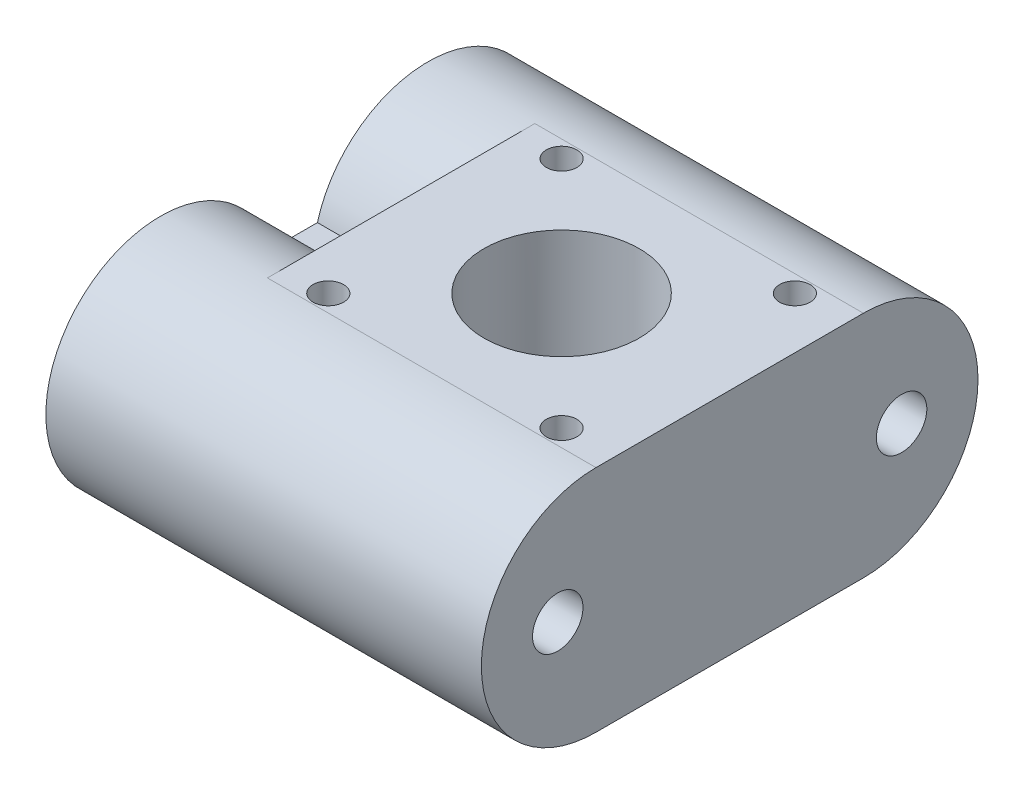
from build123d import *

# Parameters (mm, degrees)
SKETCH1_W             = 35
SKETCH1_H             = 32.5
BOSS_EXTRUDE1_DEPTH   = 15
SKETCH2_R             = 5.08
CUT_EXTRUDE2_DEPTH    = 30
SKETCH4_R             = 1
CUT_EXTRUDE3_DEPTH    = 15
M4X0_7_TAPPED_HOLE1_D = 3.3
FILLET1_RADIUS        = 7.5
FILLET1_LENGTH        = 35
FILLET2_RADIUS        = 7.5
FILLET2_LENGTH        = 35
SKETCH19_W            = 6.5
SKETCH19_H            = 32.5
CUT_EXTRUDE13_DEPTH   = 29.201285432
CUT_EXTRUDE14_START   = -7
CUT_EXTRUDE14_DEPTH   = 7


# Read off the part's stored shape, not the designer's step: Cut-Extrude14
with BuildPart() as part:
    # Sketch1 → Boss-Extrude1 (new body)
    with BuildSketch(Plane(origin=(0, 0, 0), x_dir=(1, 0, 0), z_dir=(0, 1, 0))):
        Rectangle(SKETCH1_W, SKETCH1_H)
    extrude(amount=-BOSS_EXTRUDE1_DEPTH)

    # Sketch2 → Cut-Extrude2 (cut)
    with BuildSketch(Plane(origin=(0, 0, 0), x_dir=(1, 0, 0), z_dir=(0, 1, 0))):
        with Locations(Location((0, 0, 0), (0, 0, 270))):
            Circle(SKETCH2_R)
    extrude(amount=-CUT_EXTRUDE2_DEPTH, mode=Mode.SUBTRACT)

    # Sketch4 → Cut-Extrude3 (cut)
    with BuildSketch(Plane(origin=(0, 0, 0), x_dir=(1, 0, 0), z_dir=(0, 1, 0))):
        with Locations(Location((7.633, 7.633, 0), (0, 0, 270))):
            Circle(SKETCH4_R)
        with Locations(Location((-7.633, 7.633, 0), (0, 0, 270))):
            Circle(SKETCH4_R)
        with Locations(Location((-7.633, -7.633, 0), (0, 0, 270))):
            Circle(SKETCH4_R)
        with Locations(Location((7.633, -7.633, 0), (0, 0, 270))):
            Circle(SKETCH4_R)
    extrude(amount=-CUT_EXTRUDE3_DEPTH, mode=Mode.SUBTRACT)

    # M4x0.7 Tapped Hole1 (through all)
    with Locations(Plane(origin=(-17.5, 0, 0), x_dir=(0, -1, 0), z_dir=(-1, 0, 0))):
        with Locations((7.5, -11.25), (7.5, 11.25)):
            Hole(M4X0_7_TAPPED_HOLE1_D / 2)

    # Fillet1: full round fillet: the end face becomes a half cylinder, R = half its width
    fillet1_face = Plane((0, -7.5, -16.25), x_dir=(1, 0, 0), z_dir=(0, 0, -1))  # on the end face: x along it, z out of the body
    fillet1_slab = fillet1_face.offset(-FILLET1_RADIUS / 2) * Box(FILLET1_LENGTH, 2 * FILLET1_RADIUS, FILLET1_RADIUS, mode=Mode.PRIVATE)  # the body's end, R deep
    fillet1_round = Plane((0, -7.5, -8.75), x_dir=(0, 0, -1), z_dir=(1, 0, 0)) * Cylinder(FILLET1_RADIUS, FILLET1_LENGTH, mode=Mode.PRIVATE)  # its axis R under the face
    add(fillet1_slab - fillet1_round, mode=Mode.SUBTRACT)

    # Fillet2: full round fillet: the end face becomes a half cylinder, R = half its width
    fillet2_face = Plane((0, -7.5, 16.25), x_dir=(1, 0, 0), z_dir=(0, 0, 1))  # on the end face: x along it, z out of the body
    fillet2_slab = fillet2_face.offset(-FILLET2_RADIUS / 2) * Box(FILLET2_LENGTH, 2 * FILLET2_RADIUS, FILLET2_RADIUS, mode=Mode.PRIVATE)  # the body's end, R deep
    fillet2_round = Plane((0, -7.5, 8.75), x_dir=(0, 0, 1), z_dir=(1, 0, 0)) * Cylinder(FILLET2_RADIUS, FILLET2_LENGTH, mode=Mode.PRIVATE)  # its axis R under the face
    add(fillet2_slab - fillet2_round, mode=Mode.SUBTRACT)

    # Sketch19 → Cut-Extrude13 (cut, through all)
    with BuildSketch(Plane.XZ.offset(15)):
        with Locations((14.25, 0)):
            Rectangle(SKETCH19_W, SKETCH19_H)
    extrude(amount=-CUT_EXTRUDE13_DEPTH, mode=Mode.SUBTRACT)

    # Cut-Extrude14 outline → Cut-Extrude14 (cut)
    with BuildSketch(Plane.ZY.offset(17.5).offset(CUT_EXTRUDE14_START)):
        with BuildLine():
            Line((-1.521583853, -5.5), (1.521583853, -5.5))
            ThreePointArc((1.521583853, -5.5), (4.208524469, -1.531331807), (8.75, 0))
            Line((8.75, 0), (-8.75, 0))
            ThreePointArc((-8.75, 0), (-4.208524469, -1.531331807), (-1.521583853, -5.5))
        make_face()
        with BuildLine():
            Line((-8.75, -15), (8.75, -15))
            ThreePointArc((8.75, -15), (4.208524469, -13.468668193), (1.521583853, -9.5))
            Line((1.521583853, -9.5), (-1.521583853, -9.5))
            ThreePointArc((-1.521583853, -9.5), (-4.208524469, -13.468668193), (-8.75, -15))
        make_face()
    extrude(amount=CUT_EXTRUDE14_DEPTH, mode=Mode.SUBTRACT)


solid = part.part
